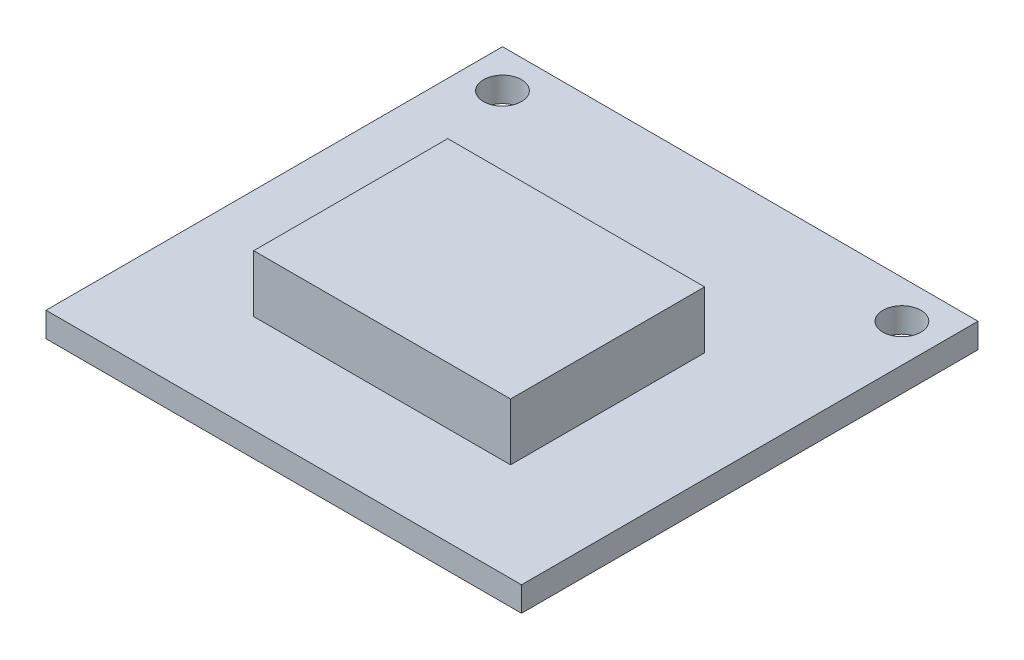
from build123d import *

# Parameters (mm, degrees)
SKETCH1_W           = 25
SKETCH1_H           = 24
SKETCH1_R           = 1
BOSS_EXTRUDE1_DEPTH = 1.3
SKETCH2_W           = 13.502884402
SKETCH2_H           = 10.204469891
BOSS_EXTRUDE2_DEPTH = 3


with BuildPart() as part:
    # Sketch1 → Boss-Extrude1 (new body)
    with BuildSketch(Plane(origin=(0, 0, 0), x_dir=(1, 0, 0), z_dir=(0, 1, 0))):
        Rectangle(SKETCH1_W, SKETCH1_H)
        with Locations((10.5, 10)):
            Circle(SKETCH1_R, mode=Mode.SUBTRACT)
        with Locations((-10.5, 10)):
            Circle(SKETCH1_R, mode=Mode.SUBTRACT)
    extrude(amount=BOSS_EXTRUDE1_DEPTH)

    # Sketch2 → Boss-Extrude2 (add)
    with BuildSketch(Plane(origin=(0, 1.3, 0), x_dir=(1, 0, 0), z_dir=(0, 1, 0))):
        with Locations((0, -1.726513846)):
            Rectangle(SKETCH2_W, SKETCH2_H)
    extrude(amount=BOSS_EXTRUDE2_DEPTH)


solid = part.part
